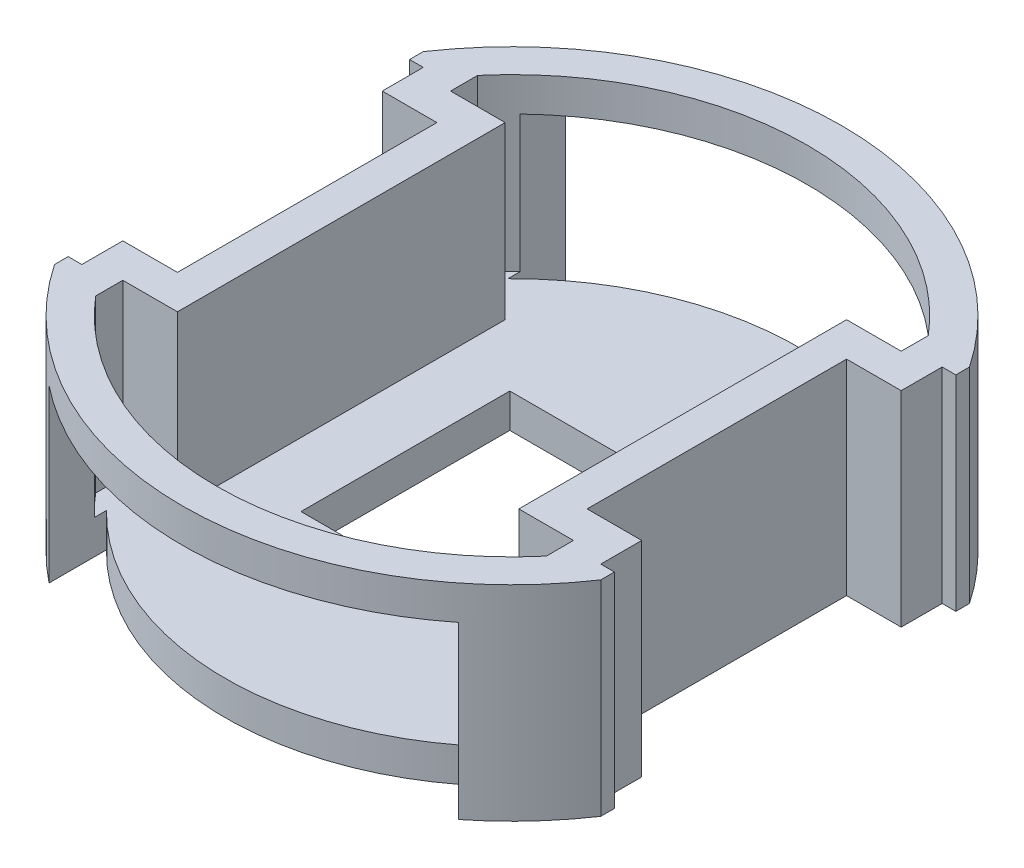
from build123d import *

# Parameters (mm, degrees)
EXTRUDE_1_DEPTH     = 30
SHELL_START         = 5
SHELL_1_DEPTH       = 25
SKETCH_3_W          = 31.232058984
SKETCH_3_H          = 30.58107444
CUT_EXTRUDE_1_DEPTH = 25


# Read off the part's stored shape, not the designer's step: 抽壳1
with BuildPart() as part:
    # 草图1 → 凸台-拉伸1 (new body)
    with BuildSketch(Plane(origin=(0, 0, 0), x_dir=(1, 0, 0), z_dir=(0, 1, 0))):
        with BuildLine():
            Line((-40, -27), (-40, -25))
            Line((-40, -25), (-38, -25))
            Line((-38, -25), (-38, -19))
            Line((-38, -19), (-30, -19))
            Line((-30, -19), (-30, 19))
            Line((-30, 19), (-38, 19))
            Line((-38, 19), (-38, 25))
            Line((-38, 25), (-40, 25))
            Line((-40, 25), (-40, 27))
            ThreePointArc((-40, 27), (0, 48.259714048), (40, 27))
            Line((40, 27), (40, 25))
            Line((40, 25), (38, 25))
            Line((38, 25), (38, 19))
            Line((38, 19), (30, 19))
            Line((30, 19), (30, -19))
            Line((30, -19), (38, -19))
            Line((38, -19), (38, -25))
            Line((38, -25), (40, -25))
            Line((40, -25), (40, -27))
            ThreePointArc((40, -27), (0, -48.259714048), (-40, -27))
        make_face()
    extrude(amount=EXTRUDE_1_DEPTH)

    # 抽壳1 outline → 抽壳1 (cut)
    with BuildSketch(Plane(origin=(0, 0, 0), x_dir=(1, 0, 0), z_dir=(0, 1, 0)).offset(SHELL_START)):
        with BuildLine():
            Line((-33, -24), (-33, -27.971465094))
            ThreePointArc((-33, -27.971465094), (0, -43.259714048), (33, -27.971465094))
            Line((33, -27.971465094), (33, -24))
            Line((33, -24), (25, -24))
            Line((25, -24), (25, 24))
            Line((25, 24), (33, 24))
            Line((33, 24), (33, 27.971465094))
            ThreePointArc((33, 27.971465094), (0, 43.259714048), (-33, 27.971465094))
            Line((-33, 27.971465094), (-33, 24))
            Line((-33, 24), (-25, 24))
            Line((-25, 24), (-25, -24))
            Line((-25, -24), (-33, -24))
        make_face()
    extrude(amount=SHELL_1_DEPTH, mode=Mode.SUBTRACT)

    # 草图3 → 切除-拉伸1 (cut)
    with BuildSketch(Plane.XZ):
        with BuildLine():
            Line((-30, 29.393876913), (-30, 37.802116343))
            ThreePointArc((-30, 37.802116343), (0, 48.259714048), (30, 37.802116343))
            Line((30, 37.802116343), (30, 29.393876913))
            ThreePointArc((30, 29.393876913), (0, 42), (-30, 29.393876913))
        make_face()
        with BuildLine():
            Line((-30, -29.393876913), (-30, -37.802116343))
            ThreePointArc((-30, -37.802116343), (0, -48.259714048), (30, -37.802116343))
            Line((30, -37.802116343), (30, -29.393876913))
            ThreePointArc((30, -29.393876913), (0, -42), (-30, -29.393876913))
        make_face()
        Rectangle(SKETCH_3_W, SKETCH_3_H)
    extrude(amount=-CUT_EXTRUDE_1_DEPTH, mode=Mode.SUBTRACT)


solid = part.part
